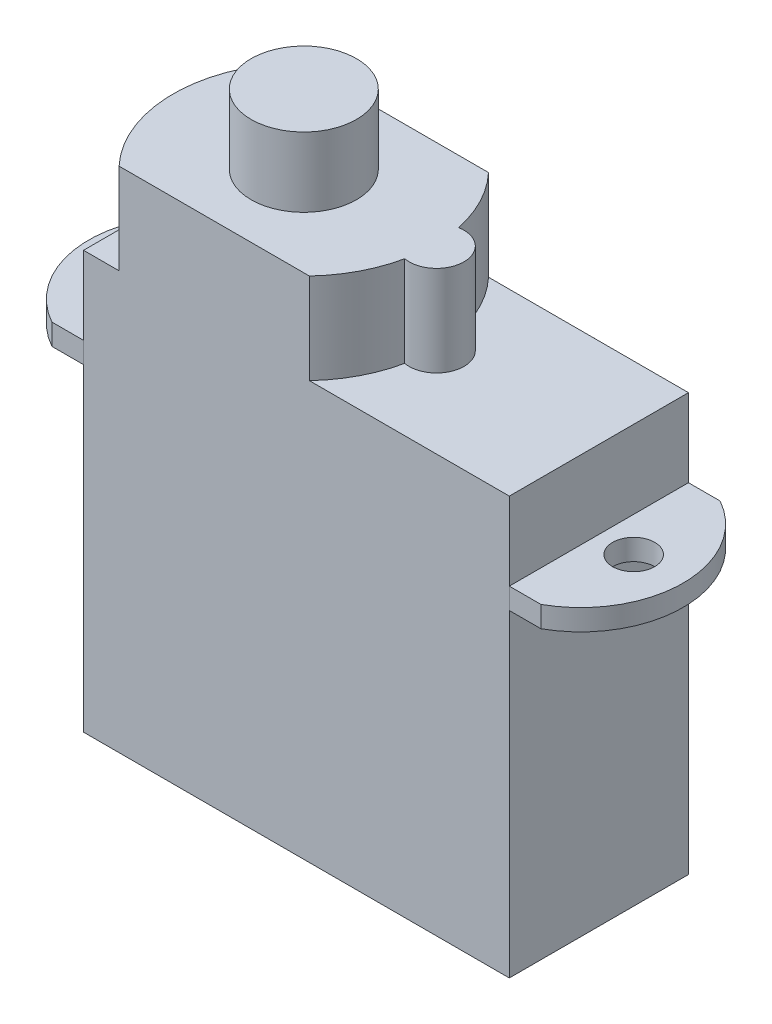
from build123d import *

# Parameters (mm, degrees)
SKETCH1_W                  = 20.2
SKETCH1_H                  = 8.5
BOSS_EXTRUDE1_DEPTH        = 19.8
SKETCH2_W                  = 8.5
SKETCH2_H                  = 1
BOSS_EXTRUDE2_DEPTH        = 5
SKETCH3_W                  = 8.5
SKETCH3_H                  = 1
BOSS_EXTRUDE3_DEPTH        = 5
SKETCH4_R                  = 1
CUT_EXTRUDE1_DEPTH         = 2.5
BOSS_EXTRUDE4_DEPTH        = 4.3
SKETCH7_R                  = 2.5
BOSS_EXTRUDE5_DEPTH        = 3.3
SKETCH8_R                  = 0.6
BOSS_EXTRUDE7_DEPTH        = 2.3
BOSS_EXTRUDE7_2_DEPTH      = 2.3
BOSS_EXTRUDE7_3_DEPTH      = 2.3
WYTNIJ_WYCI_GNI_CIE1_DEPTH = 23.478489718
SKETCH4_5_R                = 1
WYTNIJ_WYCI_GNI_CIE2_DEPTH = 22.819314838


# Read off the part's stored shape, not the designer's step: Boss-Extrude4
with BuildPart() as part:
    # Sketch1 → Boss-Extrude1 (new body)
    with BuildSketch(Plane(origin=(0, 0, 0), x_dir=(1, 0, 0), z_dir=(0, 1, 0))):
        Rectangle(SKETCH1_W, SKETCH1_H)
    extrude(amount=BOSS_EXTRUDE1_DEPTH)

    # Boss-Extrude4 outline → Boss-Extrude4 (add)
    with BuildSketch(Plane(origin=(0, 19.8, 0), x_dir=(1, 0, 0), z_dir=(0, 1, 0))):
        with BuildLine():
            Line((0.614144437, 4.25), (-8.414144437, 4.25))
            ThreePointArc((-8.414144437, 4.25), (-10.1, 0), (-8.414144437, -4.25))
            Line((-8.414144437, -4.25), (0.614144437, -4.25))
            ThreePointArc((0.614144437, -4.25), (1.595022014, -2.871364322), (2.166666667, -1.278888406))
            ThreePointArc((2.166666667, -1.278888406), (3.7, 0), (2.166666667, 1.278888406))
            ThreePointArc((2.166666667, 1.278888406), (1.595022014, 2.871364322), (0.614144437, 4.25))
        make_face()
    extrude(amount=BOSS_EXTRUDE4_DEPTH)

    # Sketch7 → Boss-Extrude5 (add)
    with BuildSketch(Plane(origin=(0, 24.1, 0), x_dir=(1, 0, 0), z_dir=(0, 1, 0))):
        with Locations(Location((-3.9, 0, 0), (0, 0, 270))):
            Circle(SKETCH7_R)
    extrude(amount=BOSS_EXTRUDE5_DEPTH)


with BuildPart() as body_2:
    # Sketch2 → Boss-Extrude2 (new body)
    with BuildSketch(Plane(origin=(10.1, 0, 0), x_dir=(0, 0, -1), z_dir=(1, 0, 0))):
        with Locations((0, 15.6)):
            Rectangle(SKETCH2_W, SKETCH2_H)
    extrude(amount=BOSS_EXTRUDE2_DEPTH)

    # Sketch4<4> → Wytnij-wyciągnięcie1 (cut, through all)
    with BuildSketch(Plane(origin=(0, 16.1, 0), x_dir=(1, 0, 0), z_dir=(0, 1, 0))):
        with BuildLine():
            Line((15.1, 4.25), (11.6, 4.25))
            ThreePointArc((11.6, 4.25), (14.1, 0), (11.6, -4.25))
            Line((11.6, -4.25), (15.1, -4.25))
            Line((15.1, -4.25), (15.1, 4.25))
        make_face()
    extrude(amount=-WYTNIJ_WYCI_GNI_CIE1_DEPTH, mode=Mode.SUBTRACT)

    # Sketch4<5> → Wytnij-wyciągnięcie2 (cut, through all)
    with BuildSketch(Plane(origin=(0, 16.1, 0), x_dir=(1, 0, 0), z_dir=(0, 1, 0))):
        with Locations(Location((11.75, 0, 0), (0, 0, 270))):
            Circle(SKETCH4_5_R)
    extrude(amount=-WYTNIJ_WYCI_GNI_CIE2_DEPTH, mode=Mode.SUBTRACT)


with BuildPart() as body_3:
    # Sketch3 → Boss-Extrude3 (new body)
    with BuildSketch(Plane.ZY.offset(10.1)):
        with Locations((0, 15.6)):
            Rectangle(SKETCH3_W, SKETCH3_H)
    extrude(amount=BOSS_EXTRUDE3_DEPTH)

    # Sketch4 → Cut-Extrude1 (cut)
    with BuildSketch(Plane(origin=(0, 16.1, 0), x_dir=(1, 0, 0), z_dir=(0, 1, 0))):
        with BuildLine():
            ThreePointArc((-11.6, -4.25), (-14.1, 0), (-11.6, 4.25))
            Line((-11.6, 4.25), (-15.1, 4.25))
            Line((-15.1, 4.25), (-15.1, -4.25))
            Line((-15.1, -4.25), (-11.6, -4.25))
        make_face()
        with Locations(Location((-11.75, 0, 0), (0, 0, 270))):
            Circle(SKETCH4_R)
    extrude(amount=-CUT_EXTRUDE1_DEPTH, mode=Mode.SUBTRACT)


with BuildPart() as body_4:
    # Sketch8 → Boss-Extrude7 (new body)
    with BuildSketch(Plane.ZY.offset(10.1)):
        with Locations((0, 4.5)):
            Circle(SKETCH8_R)
    extrude(amount=BOSS_EXTRUDE7_DEPTH)


with BuildPart() as body_5:
    # Sketch8 → Boss-Extrude7 2 (new body)
    with BuildSketch(Plane.ZY.offset(10.1)):
        with Locations((-1.2, 4.5)):
            Circle(SKETCH8_R)
    extrude(amount=BOSS_EXTRUDE7_2_DEPTH)


with BuildPart() as body_6:
    # Sketch8 → Boss-Extrude7 3 (new body)
    with BuildSketch(Plane.ZY.offset(10.1)):
        with Locations((1.2, 4.5)):
            Circle(SKETCH8_R)
    extrude(amount=BOSS_EXTRUDE7_3_DEPTH)


solid = Compound([part.part, body_2.part, body_3.part, body_4.part, body_5.part, body_6.part])
